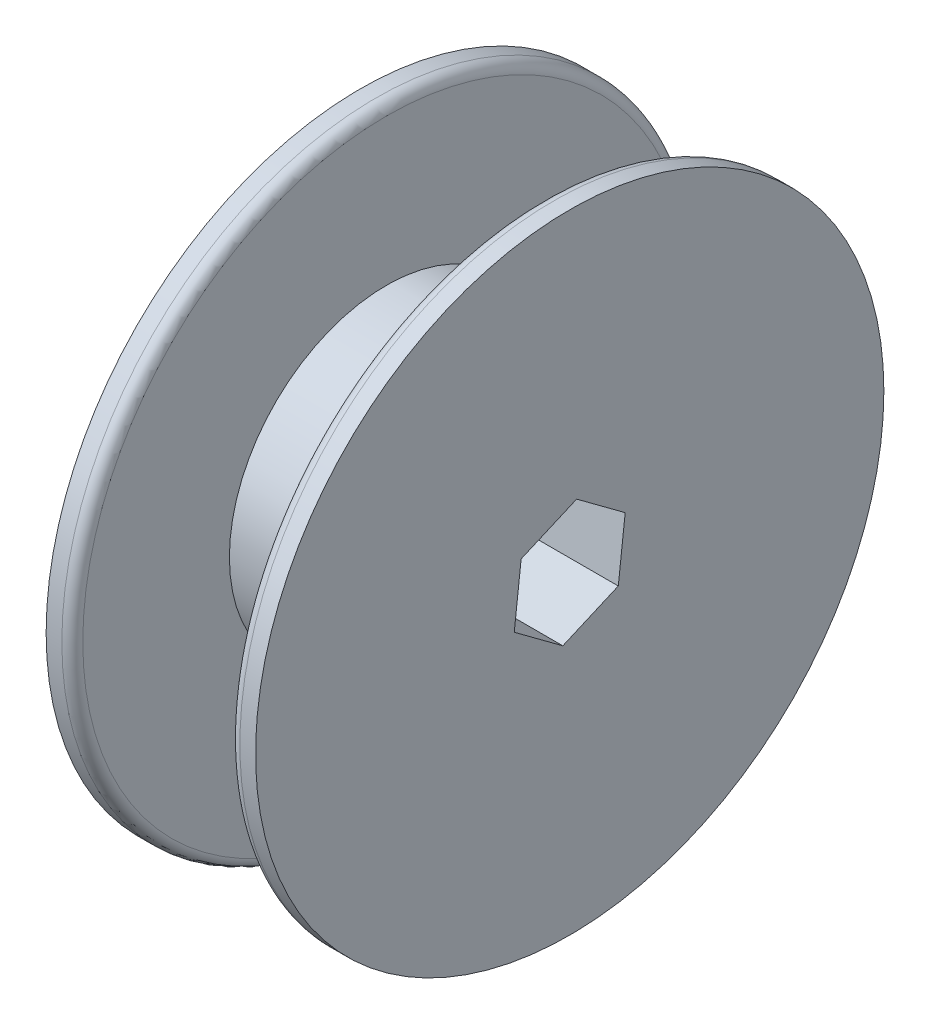
from build123d import *

# Parameters (mm, degrees)
SKETCH1_R           = 19.05
BOSS_EXTRUDE1_DEPTH = 19.05
SKETCH2_R           = 38.1
BOSS_EXTRUDE2_DEPTH = 3.175
BOSS_EXTRUDE3_START = 3.175
SKETCH3_R           = 38.1
BOSS_EXTRUDE3_DEPTH = 3.175
SKETCH4_R           = 6.35
CUT_EXTRUDE1_DEPTH  = 60.56828015
FILLET1_R           = 1.27
CUT_EXTRUDE2_DEPTH  = 60.56828015


with BuildPart() as part:
    # Sketch1 → Boss-Extrude1 (new body)
    with BuildSketch(Plane(origin=(0, 0, 0), x_dir=(0, 0, -1), z_dir=(1, 0, 0))):
        Circle(SKETCH1_R)
    extrude(amount=BOSS_EXTRUDE1_DEPTH)

    # Sketch2 → Boss-Extrude2 (add)
    with BuildSketch(Plane.ZY):
        Circle(SKETCH2_R)
    extrude(amount=BOSS_EXTRUDE2_DEPTH)

    # Sketch3 → Boss-Extrude3 (add)
    with BuildSketch(Plane(origin=(19.05, 0, 0), x_dir=(0, 0, -1), z_dir=(1, 0, 0)).offset(BOSS_EXTRUDE3_START)):
        Circle(SKETCH3_R)
    extrude(amount=-BOSS_EXTRUDE3_DEPTH)

    # Sketch4 → Cut-Extrude1 (cut, through all)
    with BuildSketch(Plane.ZY.offset(3.175)):
        Circle(SKETCH4_R)
    extrude(amount=-CUT_EXTRUDE1_DEPTH, mode=Mode.SUBTRACT)

    # Fillet1
    fillet1_edges = [part.edges().sort_by_distance(p)[0] for p in [
        (0, 0, -38.1),
        (19.05, 0, 38.1),
    ]]
    fillet(fillet1_edges, radius=FILLET1_R)

    # Sketch5 → Cut-Extrude2 (cut, through all)
    with BuildSketch(Plane.ZY.offset(3.175)):
        Polygon((-5.890350999, -4.366588879), (0.836401397, -7.284488042), (6.726752397, -2.917899163), (5.890350999, 4.366588879), (-0.836401397, 7.284488042), (-6.726752397, 2.917899163), align=None)
    extrude(amount=-CUT_EXTRUDE2_DEPTH, mode=Mode.SUBTRACT)


solid = part.part
